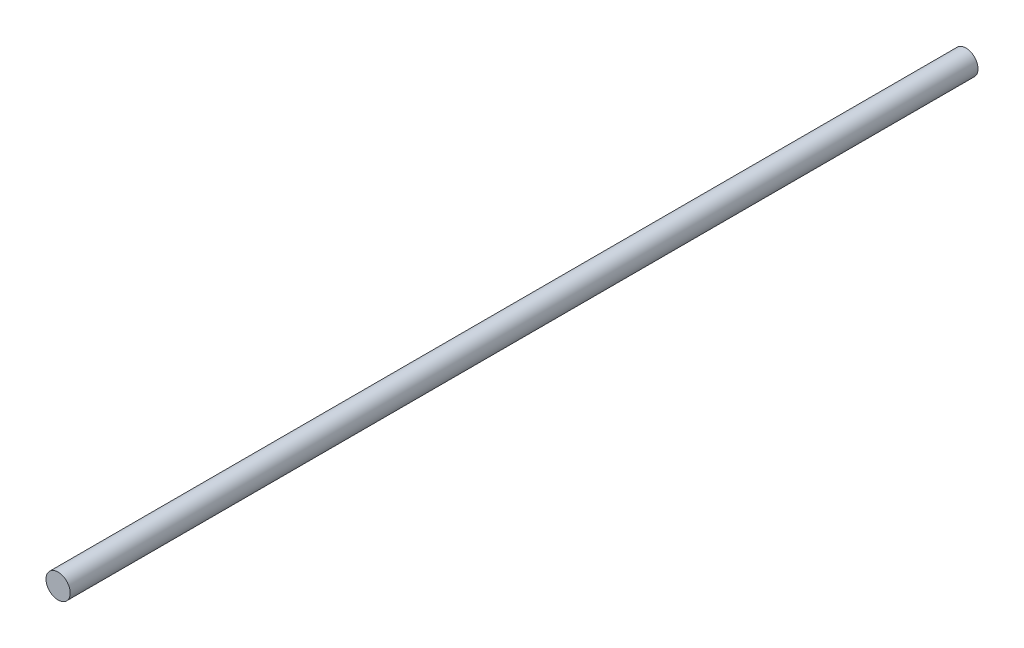
from build123d import *

# Parameters (mm, degrees)
SKETCH_1_R      = 6
EXTRUDE_1_DEPTH = 450


with BuildPart() as part:
    # Эскиз1 → Бобышка-Вытянуть1 (new body)
    with BuildSketch(Plane.XY):
        Circle(SKETCH_1_R)
    extrude(amount=EXTRUDE_1_DEPTH)


solid = part.part
